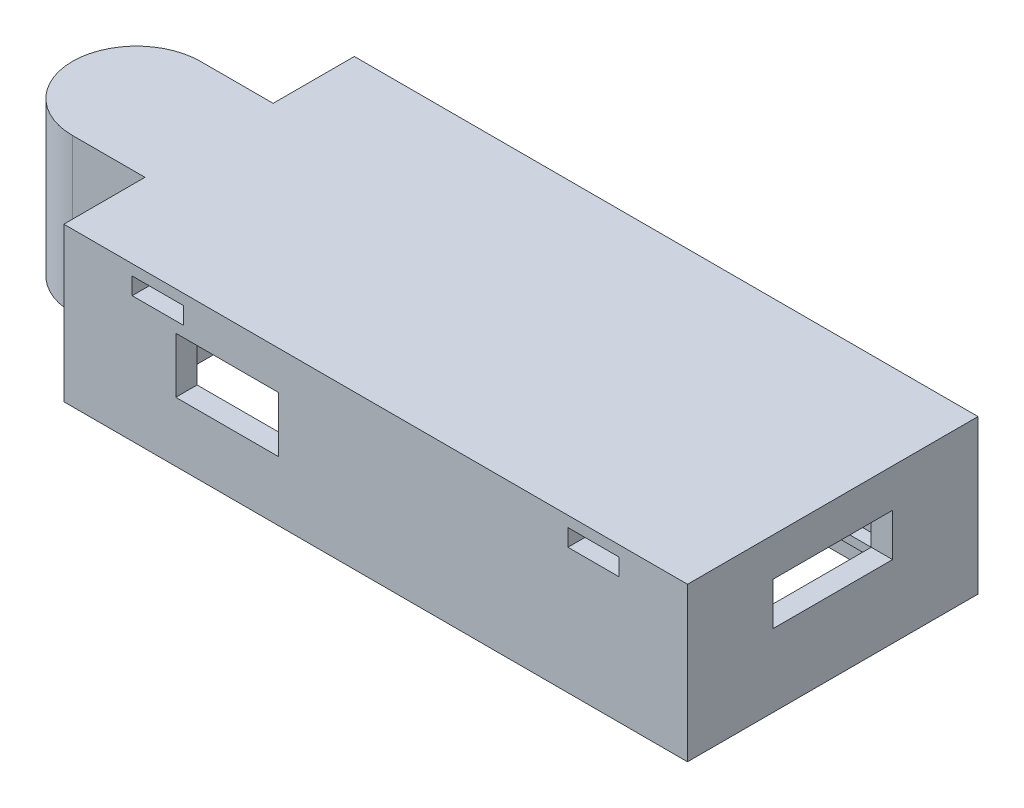
from build123d import *

# Parameters (mm, degrees)
SKETCH1_W             = 73
SKETCH1_H             = 34
BASE_DEPTH            = 4.5
SKETCH21_W            = 73
SKETCH21_H            = 34
EXTRUDE_UP_DEPTH      = 13.5
SKETCH22_W            = 68
SKETCH22_H            = 29
CUT_DOWN_DEPTH        = 13.5
SKETCH27_R            = 2
BOSS_EXTRUDE15_DEPTH  = 1.5
SKETCH29_R            = 2
BOSS_EXTRUDE16_DEPTH  = 1.5
SKETCH30_R            = 2
BOSS_EXTRUDE17_DEPTH  = 1.5
SKETCH28_R            = 2
BOSS_EXTRUDE18_DEPTH  = 1.5
SKETCH31_R            = 1.5
BOSS_EXTRUDE19_DEPTH  = 2
SKETCH32_R            = 1.5
BOSS_EXTRUDE20_DEPTH  = 2
SKETCH33_R            = 1.5
BOSS_EXTRUDE21_DEPTH  = 2
SKETCH34_R            = 1.5
BOSS_EXTRUDE22_DEPTH  = 2
SKETCH39_W            = 19
SKETCH39_H            = 1.3
WALL_SLIT_DEPTH       = 1.5
SKETCH41_W            = 2.5
SKETCH41_H            = 24
OUTSIDE_BLOCK_DEPTH   = 5
SKETCH44_W            = 2.5
SKETCH44_H            = 24
INSIDE_BLOCK_DEPTH    = 5
SKETCH45_W            = 12
SKETCH45_H            = 6.5
USB_HOLE_DEPTH        = 2.5
SKETCH62_W            = 70
SKETCH62_H            = 31
RAISE_LIP_DEPTH       = 1.5
SKETCH63_W            = 68
SKETCH63_H            = 29
CUT_LIP_DEPTH         = 1.5
SKETCH47_W            = 6
SKETCH47_H            = 2
TOP_TIE_HOLE_DEPTH    = 34
SKETCH48_W            = 6
SKETCH48_H            = 2
BOTTOM_TIE_HOLE_DEPTH = 34
SKETCH56_W            = 14
SKETCH56_H            = 5
WIRE_HOLE_DEPTH       = 2.5
SKETCH68_W            = 68
SKETCH68_H            = 1
RIGHT_LEDGE_DEPTH     = 1.5
SKETCH67_W            = 68
SKETCH67_H            = 1
LEFT_LEDGE_DEPTH      = 1.5
SKETCH65_W            = 16
SKETCH65_H            = 15
NUT_HOLE_SQUARE_DEPTH = 18
NUT_HOLE_FILLET_R     = 7.5
NUT_HOLE_HEX_DEPTH    = 15
SKETCH69_W            = 11
SKETCH69_H            = 6
CUT_EXTRUDE1_DEPTH    = 2.5
SKETCH70_R            = 2.5
CUT_EXTRUDE2_DEPTH    = 2.5


with BuildPart() as part:
    # Sketch1 → base (new body)
    with BuildSketch(Plane(origin=(0, 0, 0), x_dir=(1, 0, 0), z_dir=(0, 1, 0))):
        with Locations((5.291578947, 0.823157895)):
            Rectangle(SKETCH1_W, SKETCH1_H)
    extrude(amount=BASE_DEPTH)

    # Sketch21 → extrude up (add)
    with BuildSketch(Plane(origin=(0, 0, 0), x_dir=(-1, 0, 0), z_dir=(0, -1, 0))):
        with Locations((-5.291578947, 0.823157895)):
            Rectangle(SKETCH21_W, SKETCH21_H)
    extrude(amount=EXTRUDE_UP_DEPTH)

    # Sketch22 → cut down (cut)
    with BuildSketch(Plane(origin=(0, -13.5, 0), x_dir=(-1, 0, 0), z_dir=(0, -1, 0))):
        with Locations((-5.291578947, 0.823157895)):
            Rectangle(SKETCH22_W, SKETCH22_H)
    extrude(amount=-CUT_DOWN_DEPTH, mode=Mode.SUBTRACT)

    # Sketch27 → Boss-Extrude15 (add)
    with BuildSketch(Plane.XZ):
        with Locations(Location((31.141578947, -11.923157895, 0), (0, 0, 270))):
            Circle(SKETCH27_R)
    extrude(amount=BOSS_EXTRUDE15_DEPTH)

    # Sketch29 → Boss-Extrude16 (add)
    with BuildSketch(Plane.XZ):
        with Locations(Location((9.041578947, -11.923157895, 0), (0, 0, 270))):
            Circle(SKETCH29_R)
    extrude(amount=BOSS_EXTRUDE16_DEPTH)

    # Sketch30 → Boss-Extrude17 (add)
    with BuildSketch(Plane.XZ):
        with Locations(Location((9.041578947, 10.276842105, 0), (0, 0, 270))):
            Circle(SKETCH30_R)
    extrude(amount=BOSS_EXTRUDE17_DEPTH)

    # Sketch28 → Boss-Extrude18 (add)
    with BuildSketch(Plane.XZ):
        with Locations(Location((31.141578947, 10.276842105, 0), (0, 0, 270))):
            Circle(SKETCH28_R)
    extrude(amount=BOSS_EXTRUDE18_DEPTH)

    # Sketch31 → Boss-Extrude19 (add)
    with BuildSketch(Plane.XZ.offset(1.5)):
        with Locations(Location((31.141578947, -11.923157895, 0), (0, 0, 270))):
            Circle(SKETCH31_R)
    extrude(amount=BOSS_EXTRUDE19_DEPTH)

    # Sketch32 → Boss-Extrude20 (add)
    with BuildSketch(Plane.XZ.offset(1.5)):
        with Locations(Location((9.041578947, -11.923157895, 0), (0, 0, 270))):
            Circle(SKETCH32_R)
    extrude(amount=BOSS_EXTRUDE20_DEPTH)

    # Sketch33 → Boss-Extrude21 (add)
    with BuildSketch(Plane.XZ.offset(1.5)):
        with Locations(Location((9.041578947, 10.276842105, 0), (0, 0, 270))):
            Circle(SKETCH33_R)
    extrude(amount=BOSS_EXTRUDE21_DEPTH)

    # Sketch34 → Boss-Extrude22 (add)
    with BuildSketch(Plane.XZ.offset(1.5)):
        with Locations(Location((31.141578947, 10.276842105, 0), (0, 0, 270))):
            Circle(SKETCH34_R)
    extrude(amount=BOSS_EXTRUDE22_DEPTH)

    # Sketch39 → wall slit (cut)
    with BuildSketch(Plane.XY.offset(-15.323157895)):
        with Locations((-11.708421053, -4.85)):
            Rectangle(SKETCH39_W, SKETCH39_H)
    extrude(amount=-WALL_SLIT_DEPTH, mode=Mode.SUBTRACT)

    # Sketch41 → outside block (add)
    with BuildSketch(Plane.XZ):
        with Locations((-27.458421053, -0.823157895)):
            Rectangle(SKETCH41_W, SKETCH41_H)
    extrude(amount=OUTSIDE_BLOCK_DEPTH)

    # Sketch44 → inside block (add)
    with BuildSketch(Plane.XZ):
        with Locations((4.041578947, -0.823157895)):
            Rectangle(SKETCH44_W, SKETCH44_H)
    extrude(amount=INSIDE_BLOCK_DEPTH)

    # Sketch45 → usb hole (cut)
    with BuildSketch(Plane(origin=(0, 0, 13.676842105), x_dir=(-1, 0, 0), z_dir=(0, 0, -1))):
        with Locations((12.108421053, -3.25)):
            Rectangle(SKETCH45_W, SKETCH45_H)
    extrude(amount=-USB_HOLE_DEPTH, mode=Mode.SUBTRACT)

    # Sketch62 → raise lip (add)
    with BuildSketch(Plane.XZ.offset(13.5)):
        with Locations((5.291578947, -0.823157895)):
            Rectangle(SKETCH62_W, SKETCH62_H)
    extrude(amount=RAISE_LIP_DEPTH)

    # Sketch63 → cut lip (cut)
    with BuildSketch(Plane.XZ.offset(15)):
        with Locations((5.291578947, -0.823157895)):
            Rectangle(SKETCH63_W, SKETCH63_H)
    extrude(amount=-CUT_LIP_DEPTH, mode=Mode.SUBTRACT)

    # Sketch47 → top tie hole (cut)
    with BuildSketch(Plane.XY.offset(16.176842105)):
        with Locations((30.791578947, 2.25)):
            Rectangle(SKETCH47_W, SKETCH47_H)
    extrude(amount=-TOP_TIE_HOLE_DEPTH, mode=Mode.SUBTRACT)

    # Sketch48 → bottom tie hole (cut)
    with BuildSketch(Plane.XY.offset(16.176842105)):
        with Locations((-20.208421053, 2.25)):
            Rectangle(SKETCH48_W, SKETCH48_H)
    extrude(amount=-BOTTOM_TIE_HOLE_DEPTH, mode=Mode.SUBTRACT)

    # Sketch56 → wire hole (cut)
    with BuildSketch(Plane.ZY.offset(-39.291578947)):
        with Locations((-0.823157895, -2.5)):
            Rectangle(SKETCH56_W, SKETCH56_H)
    extrude(amount=-WIRE_HOLE_DEPTH, mode=Mode.SUBTRACT)

    # Sketch68 → right ledge (add)
    with BuildSketch(Plane.XY.offset(-15.323157895)):
        with Locations((5.291578947, -11.5)):
            Rectangle(SKETCH68_W, SKETCH68_H)
    extrude(amount=RIGHT_LEDGE_DEPTH)

    # Sketch67 → left ledge (add)
    with BuildSketch(Plane(origin=(0, 0, 13.676842105), x_dir=(-1, 0, 0), z_dir=(0, 0, -1))):
        with Locations((-5.291578947, -11.5)):
            Rectangle(SKETCH67_W, SKETCH67_H)
    extrude(amount=LEFT_LEDGE_DEPTH)

    # Sketch65 → nut hole square (add)
    with BuildSketch(Plane.XZ.offset(13.5)):
        with Locations((-39.208421053, -0.823157895)):
            Rectangle(SKETCH65_W, SKETCH65_H)
    extrude(amount=-NUT_HOLE_SQUARE_DEPTH)

    # nut hole fillet
    nut_hole_fillet_edges = [part.edges().sort_by_distance(p)[0] for p in [
        (-47.208421053, -4.5, -8.323157895),
        (-47.208421053, -4.5, 6.676842105),
    ]]
    fillet(nut_hole_fillet_edges, radius=NUT_HOLE_FILLET_R - 0.0001)  # a hair under: the kernel refuses the full size

    # Sketch66 → nut hole hex (cut)
    with BuildSketch(Plane.XZ.offset(13.5)):
        Polygon((-35.028097876, 5.551348835), (-42.388744229, 5.551348835), (-46.069067406, -0.823157895), (-42.388744229, -7.197664625), (-35.028097876, -7.197664625), (-31.347774699, -0.823157895), align=None)
    extrude(amount=-NUT_HOLE_HEX_DEPTH, mode=Mode.SUBTRACT)

    # Sketch69 → Cut-Extrude1 (cut)
    with BuildSketch(Plane.XY.offset(-15.323157895)):
        with Locations((28.791578947, -7)):
            Rectangle(SKETCH69_W, SKETCH69_H)
    extrude(amount=-CUT_EXTRUDE1_DEPTH, mode=Mode.SUBTRACT)

    # Sketch70 → Cut-Extrude2 (cut)
    with BuildSketch(Plane.XY.offset(-15.323157895)):
        with Locations((13.291578947, -7)):
            Circle(SKETCH70_R)
    extrude(amount=-CUT_EXTRUDE2_DEPTH, mode=Mode.SUBTRACT)


solid = part.part
